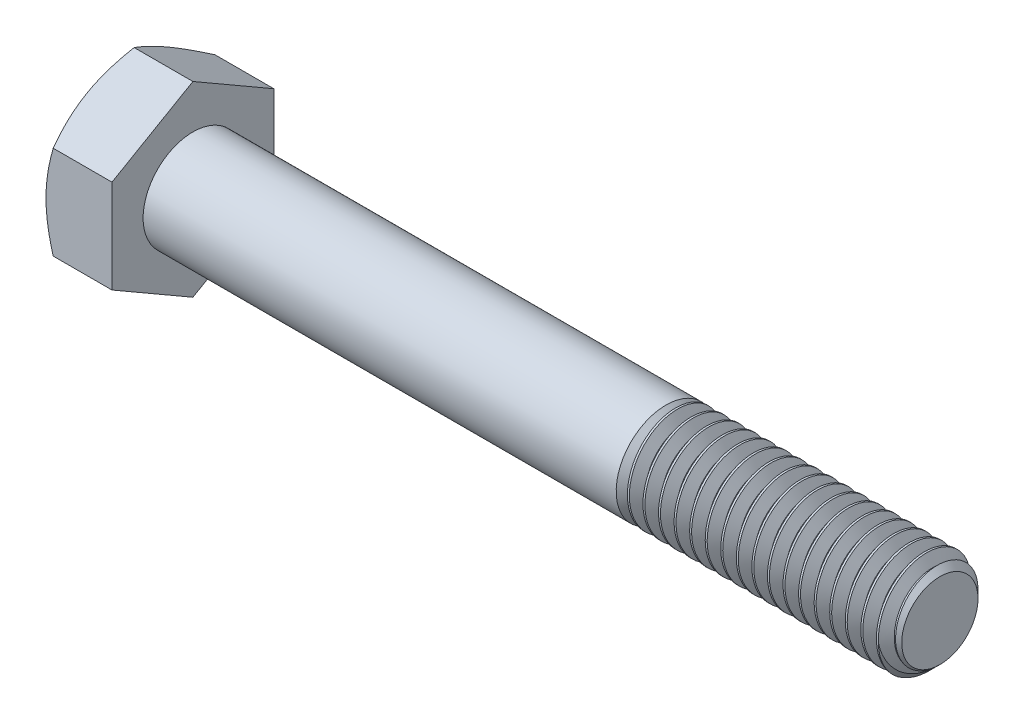
from build123d import *

# Parameters (mm, degrees)
SKETCH2_R           = 4
BOSS_EXTRUDE1_DEPTH = 60
CHAMFER1_SIZE       = 0.9375
CUT_SWEEP1_PITCH    = 1.25
BOSS_EXTRUDE2_DEPTH = 5.3
SKETCH6_OUTSIDE_W   = 260.92
SKETCH6_OUTSIDE_H   = 262.932
SKETCH6_OUTSIDE_R   = 6.5
CUT_EXTRUDE1_DEPTH  = 67.050536328
CUT_EXTRUDE1_DRAFT  = -60
SKETCH7_W           = 0.263417301
SKETCH7_H           = 0.263417301
CUT_EXTRUDE2_DEPTH  = 0.25


with BuildPart() as part:
    # Sketch2 → Boss-Extrude1 (new body)
    with BuildSketch(Plane(origin=(32.65, 0, 0), x_dir=(0, 0, -1), z_dir=(1, 0, 0))):
        Circle(SKETCH2_R)
    extrude(amount=-BOSS_EXTRUDE1_DEPTH)

    # Chamfer1
    chamfer1_edges = [part.edges().sort_by_distance(p)[0] for p in [
        (32.65, 0, 4),
    ]]
    chamfer(chamfer1_edges, length=CHAMFER1_SIZE)

    # Cut-Sweep1: arcs per turn and ends read off the stored shape
    # Cut-Sweep1: the profile of Sketch5 profile screwed along a right-hand helix through 49 turns, 8 arcs to a turn; built about Z, then put on its axis
    cut_sweep1_z = Axis((0, 0, 0), (0, 0, 1))
    cut_sweep1_corners = [(4.0003, 0, 0.000173205), (3.188101184, 0, -0.46875), (3.188101184, 0, -0.625), (4.0003, 0, -1.093923205)]
    with BuildLine(mode=Mode.PRIVATE) as cut_sweep1_profile:
        Line(cut_sweep1_corners[0], cut_sweep1_corners[1])
        Line(cut_sweep1_corners[1], cut_sweep1_corners[2])
        Line(cut_sweep1_corners[2], cut_sweep1_corners[3])
        Line(cut_sweep1_corners[3], cut_sweep1_corners[0])
    cut_sweep1_cap = Face(cut_sweep1_profile.wire())
    cut_sweep1_turn_angles = [0, 22.5, 45, 67.5, 90, 112.5, 135, 157.5, 180, 202.5, 225, 247.5, 270, 292.5, 315, 337.5, 360]
    cut_sweep1_turn_weights = [1, 0.9238795325112867, 1, 0.9238795325112867, 1, 0.9238795325112867, 1, 0.9238795325112867, 1, 0.9238795325112867, 1, 0.9238795325112867, 1, 0.9238795325112867, 1, 0.9238795325112867, 1]
    cut_sweep1_turn_rails = [Edge.make_bspline([Vector(p[0], p[1], 0).rotate(cut_sweep1_z, cut_sweep1_turn_angles[k]) / cut_sweep1_turn_weights[k] + Vector(0, 0, p[2] + CUT_SWEEP1_PITCH * cut_sweep1_turn_angles[k] / 360) for k in range(17)], [0, 0, 0, 1, 1, 2, 2, 3, 3, 4, 4, 5, 5, 6, 6, 7, 7, 8, 8, 8], 2, cut_sweep1_turn_weights) for p in cut_sweep1_corners]
    cut_sweep1_turn_sides = [Face.make_surface_from_curves(cut_sweep1_turn_rails[p[0]], cut_sweep1_turn_rails[p[1]]) for p in [(0, 1), (1, 2), (2, 3), (3, 0)]]
    cut_sweep1 = Plane(origin=(32.65, 0, 0), x_dir=(0, 1, 0), z_dir=(-1, 0, 0)) * Solid(Shell([*[p.moved(Location((0, 0, CUT_SWEEP1_PITCH * i))) for i in range(49) for p in cut_sweep1_turn_sides], cut_sweep1_cap, cut_sweep1_cap.rotate(cut_sweep1_z, 17640).moved(Location((0, 0, CUT_SWEEP1_PITCH * 17640 / 360)))]))
    add(cut_sweep1, mode=Mode.SUBTRACT)

    # Sketch3 → Boss-Extrude2 (add)
    with BuildSketch(Plane.ZY.offset(27.35)):
        Polygon((-6.5, -3.75277675), (0, -7.505553499), (6.5, -3.75277675), (6.5, 3.75277675), (0, 7.505553499), (-6.5, 3.75277675), align=None)
    extrude(amount=BOSS_EXTRUDE2_DEPTH)


with BuildPart() as cut_extrude1_tool:
    # Sketch6 outside → Cut-Extrude1 (with draft: the straight prism first)
    with BuildSketch(Plane.ZY.offset(32.65)):
        Rectangle(SKETCH6_OUTSIDE_W, SKETCH6_OUTSIDE_H)
        Circle(SKETCH6_OUTSIDE_R, mode=Mode.SUBTRACT)
    extrude(amount=-CUT_EXTRUDE1_DEPTH)
    # Cut-Extrude1: the draft: its side faces are tilted about the plane it starts from
    cut_extrude1_sides = [cut_extrude1_tool.faces().sort_by_distance(p)[0] for p in [
        (0.875268164, -131.466, 0),
        (0.875268164, 0, 130.46),
        (0.875268164, 131.466, 0),
        (0.875268164, 0, -130.46),
        (0.875268164, 0, -6.5),
    ]]
    draft(cut_extrude1_sides, Plane.ZY.offset(32.65), CUT_EXTRUDE1_DRAFT)


with BuildPart() as part_1:
    add(part.part)

    # Cut-Extrude1: cut by cut_extrude1_tool
    add(cut_extrude1_tool.part, mode=Mode.SUBTRACT)

    # Sketch7 → Cut-Extrude2 (cut)
    # profile 1 of 4: a face of its own
    with BuildSketch(Plane.ZY.offset(32.65)):
        with BuildLine():
            Line((-1.712212457, 3.25), (-1.975629758, 3.25))
            Line((-1.975629758, 3.25), (-1.975629758, 4.851083283))
            add(Edge.make_bspline(
                [(-1.975629758, 4.851083283), (-1.990797349, 4.836456007), (-2.022321526, 4.806054817), (-2.075609816, 4.763029542), (-2.135086359, 4.719421601), (-2.199978812, 4.677487692), (-2.266125691, 4.638011438), (-2.330048133, 4.602508617), (-2.390678926, 4.572464616), (-2.430616757, 4.556036438), (-2.449780899, 4.548153387)],
                knots=[0, 0, 0, 0, 0.893362401, 1.856755847, 2.901947673, 4.020460078, 5.132200827, 6.168787962, 7.121294059, 8, 8, 8, 8], degree=3))
            Line((-2.449780899, 4.548153387), (-2.449780899, 4.790991211))
            add(Edge.make_bspline(
                [(-2.449780899, 4.790991211), (-2.416864504, 4.807943221), (-2.351988236, 4.841354628), (-2.260332099, 4.899060722), (-2.174761236, 4.961616503), (-2.096692183, 5.029008122), (-2.026708251, 5.097894454), (-1.967731776, 5.167403469), (-1.918384014, 5.234987266), (-1.893625307, 5.28211947), (-1.881787344, 5.304654948)],
                knots=[0, 0, 0, 0, 1.141258006, 2.249351951, 3.335817539, 4.406819942, 5.426913362, 6.360259544, 7.215985427, 8, 8, 8, 8], degree=3))
            Line((-1.881787344, 5.304654948), (-1.712212457, 5.304654948))
            Line((-1.712212457, 5.304654948), (-1.712212457, 3.25))
        make_face()
    # profile 2 of 4: a face of its own
    with BuildSketch(Plane.ZY.offset(32.65)):
        with BuildLine():
            add(Edge.make_bspline(
                [(-1.053669204, 4.26333343), (-1.053403811, 4.292696335), (-1.052884018, 4.350205901), (-1.04965991, 4.434352728), (-1.044030879, 4.514263485), (-1.035628286, 4.589868774), (-1.025678041, 4.66133925), (-1.01274266, 4.728572918), (-0.998188475, 4.791720628), (-0.980726066, 4.850716558), (-0.961540595, 4.906067965), (-0.939774065, 4.957686055), (-0.915283767, 5.005516098), (-0.889273246, 5.05005412), (-0.860373255, 5.090607372), (-0.830328139, 5.128313943), (-0.796954399, 5.161790986), (-0.761639786, 5.191899869), (-0.723864284, 5.218469203), (-0.683827763, 5.241395334), (-0.641684272, 5.261637455), (-0.596630603, 5.276875718), (-0.549602061, 5.289298133), (-0.500236646, 5.298436212), (-0.448479956, 5.303823417), (-0.413111534, 5.30437464), (-0.395125952, 5.304654948)],
                knots=[0, 0, 0, 0, 1.514747001, 2.966751498, 4.343369068, 5.64627492, 6.890416844, 8.064737671, 9.177176366, 10.232018008, 11.237056675, 12.19799043, 13.119080079, 14.007588942, 14.855863561, 15.685992447, 16.491747269, 17.290132607, 18.077525251, 18.870243746, 19.668095604, 20.485086593, 21.319398728, 22.175900658, 23.072407314, 24, 24, 24, 24], degree=3))
            add(Edge.make_bspline(
                [(-0.395125952, 5.304654948), (-0.368738762, 5.303879183), (-0.316900071, 5.302355162), (-0.241215314, 5.289925525), (-0.169887308, 5.268662714), (-0.102962395, 5.239978266), (-0.041584646, 5.203543495), (0.01322827, 5.159251481), (0.060885109, 5.107567279), (0.100865769, 5.04787845), (0.135812857, 4.981831611), (0.166859083, 4.909130317), (0.194923969, 4.82985604), (0.214839423, 4.758894496), (0.2290451, 4.697637972), (0.23844813, 4.647115325), (0.246254529, 4.592601104), (0.252235287, 4.534227193), (0.257142357, 4.472059066), (0.260931862, 4.406058014), (0.262855424, 4.336059078), (0.263226498, 4.28802977), (0.263417301, 4.26333343)],
                knots=[0, 0, 0, 0, 1.134486744, 2.228744715, 3.287356444, 4.328707449, 5.352829806, 6.347195599, 7.349461267, 8.364207941, 9.428085653, 10.559314403, 11.761222316, 13.04268526, 13.726896727, 14.465273606, 15.252205015, 16.094778733, 16.988606776, 17.934225168, 18.937792761, 20, 20, 20, 20], degree=3))
            add(Edge.make_bspline(
                [(0.263417301, 4.26333343), (0.263146937, 4.234108446), (0.262618727, 4.177011689), (0.259481011, 4.093539578), (0.253512791, 4.014231709), (0.246168788, 3.93890641), (0.23505885, 3.867764764), (0.223087289, 3.80050451), (0.208281426, 3.737431068), (0.191006459, 3.678516795), (0.171550924, 3.623450173), (0.15021492, 3.57181504), (0.126583246, 3.523646677), (0.099952535, 3.479414897), (0.071541263, 3.438532594), (0.041141347, 3.400846412), (0.008108274, 3.366898762), (-0.027524579, 3.336880189), (-0.065034849, 3.309839686), (-0.105168706, 3.286687205), (-0.147750491, 3.267505776), (-0.192495698, 3.251106608), (-0.239858332, 3.239090259), (-0.289464895, 3.229891932), (-0.341498164, 3.224475291), (-0.377003388, 3.223934368), (-0.395125952, 3.22365827)],
                knots=[0, 0, 0, 0, 1.508974709, 2.94807912, 4.311757619, 5.615040294, 6.854280449, 8.028314546, 9.141715822, 10.197470207, 11.196696834, 12.155719058, 13.080757287, 13.963948316, 14.818758719, 15.649605906, 16.461113142, 17.260189315, 18.052359509, 18.845763934, 19.647754795, 20.461145776, 21.303032214, 22.167241874, 23.064524267, 24, 24, 24, 24], degree=3))
            add(Edge.make_bspline(
                [(-0.395125952, 3.22365827), (-0.418886733, 3.224336047), (-0.465213718, 3.225657527), (-0.532870864, 3.234636168), (-0.596370704, 3.250438997), (-0.656248823, 3.271632819), (-0.711832175, 3.299980776), (-0.763386148, 3.334471601), (-0.811946681, 3.37430283), (-0.839901077, 3.405728755), (-0.854048281, 3.421632835)],
                knots=[0, 0, 0, 0, 1.10322584, 2.150986741, 3.161425019, 4.136713905, 5.093944212, 6.049774532, 7.013026876, 8, 8, 8, 8], degree=3))
            add(Edge.make_bspline(
                [(-0.854048281, 3.421632835), (-0.870332038, 3.445122393), (-0.903909841, 3.493558868), (-0.943209749, 3.57614755), (-0.978265963, 3.667066094), (-1.005778664, 3.76809831), (-1.027327966, 3.878440095), (-1.042891943, 3.998307965), (-1.051699622, 4.127650132), (-1.052997856, 4.217084674), (-1.053669204, 4.26333343)],
                knots=[0, 0, 0, 0, 0.779365345, 1.607084704, 2.489375761, 3.438383567, 4.461919411, 5.557722155, 6.737039282, 8, 8, 8, 8], degree=3))
        make_face()
        with BuildLine():
            add(Edge.make_bspline(
                [(-0.790251903, 4.264156609), (-0.789990351, 4.224638121), (-0.789489681, 4.148990994), (-0.784258903, 4.040916022), (-0.775254335, 3.943417645), (-0.763349706, 3.856630855), (-0.747630777, 3.780438257), (-0.727893802, 3.715034013), (-0.705645537, 3.659633124), (-0.678113731, 3.61492224), (-0.647969444, 3.578476348), (-0.616847528, 3.547131701), (-0.584015791, 3.52048947), (-0.549688457, 3.498275282), (-0.513332913, 3.481456158), (-0.4753467, 3.46926562), (-0.435721553, 3.462250153), (-0.408735027, 3.461242162), (-0.395125952, 3.460733841)],
                knots=[0, 0, 0, 0, 1.89448813, 3.626469325, 5.185477471, 6.587276848, 7.82441448, 8.910550357, 9.859733512, 10.6775885, 11.416198291, 12.123144072, 12.791880183, 13.439617036, 14.078171869, 14.70637855, 15.347637704, 16, 16, 16, 16], degree=3))
            add(Edge.make_bspline(
                [(-0.395125952, 3.460733841), (-0.381520284, 3.461253269), (-0.354540516, 3.462283284), (-0.314823811, 3.469144054), (-0.276985394, 3.481962153), (-0.240684056, 3.498721871), (-0.206107221, 3.520429731), (-0.17343673, 3.547172596), (-0.14215087, 3.578498631), (-0.11214199, 3.615368141), (-0.084819938, 3.660285738), (-0.062154323, 3.715641498), (-0.042724938, 3.781160284), (-0.026919756, 3.857314062), (-0.014966019, 3.943963635), (-0.006015893, 4.041191596), (-0.000750109, 4.149127511), (-0.000257703, 4.224637943), (0, 4.264156609)],
                knots=[0, 0, 0, 0, 0.652509534, 1.29391342, 1.924290653, 2.562989607, 3.207355802, 3.876242846, 4.583348185, 5.32723334, 6.150888545, 7.094226006, 8.186903555, 9.424320409, 10.81992305, 12.379283064, 14.105084285, 16, 16, 16, 16], degree=3))
            add(Edge.make_bspline(
                [(0, 4.264156609), (-0.000249452, 4.30285302), (-0.000727391, 4.376993878), (-0.006128987, 4.482986783), (-0.014593772, 4.57884869), (-0.026172254, 4.664667974), (-0.041560054, 4.740351467), (-0.060223356, 4.806060288), (-0.082463471, 4.861654304), (-0.108906889, 4.907691956), (-0.138343703, 4.94545532), (-0.169093247, 4.978142798), (-0.201924261, 5.005942433), (-0.237418413, 5.02824371), (-0.274431658, 5.046235551), (-0.313814468, 5.058617994), (-0.35517974, 5.06622538), (-0.38356819, 5.067122888), (-0.398007078, 5.067579377)],
                knots=[0, 0, 0, 0, 1.850066095, 3.544656626, 5.0727657, 6.45041401, 7.682899467, 8.762389858, 9.712573485, 10.538438529, 11.291566246, 11.996865408, 12.681389046, 13.341983376, 13.996294293, 14.643563182, 15.31009126, 16, 16, 16, 16], degree=3))
            add(Edge.make_bspline(
                [(-0.398007078, 5.067579377), (-0.411615299, 5.067222215), (-0.438448966, 5.066517937), (-0.47773697, 5.059795612), (-0.514969749, 5.048554386), (-0.550573872, 5.033327055), (-0.583660499, 5.012834074), (-0.615541766, 4.98890706), (-0.644724475, 4.959754665), (-0.66230972, 4.93796079), (-0.671302528, 4.926815757)],
                knots=[0, 0, 0, 0, 1.021318143, 2.013908504, 2.982026795, 3.937174072, 4.91255697, 5.897578595, 6.924855925, 8, 8, 8, 8], degree=3))
            add(Edge.make_bspline(
                [(-0.671302528, 4.926815757), (-0.681092952, 4.910447155), (-0.701768267, 4.875880115), (-0.724902742, 4.815801176), (-0.745338823, 4.747142384), (-0.762164493, 4.668847374), (-0.774336685, 4.581050453), (-0.78394616, 4.483853581), (-0.788937924, 4.37712106), (-0.789801826, 4.302850334), (-0.790251903, 4.264156609)],
                knots=[0, 0, 0, 0, 0.671104906, 1.417232262, 2.260109084, 3.195198885, 4.23592645, 5.382417421, 6.636286093, 8, 8, 8, 8], degree=3))
        make_face(mode=Mode.SUBTRACT)
    # profile 3 of 4: a face of its own
    with BuildSketch(Plane.ZY.offset(32.65)):
        with Locations((0.790251904, 3.381708651)):
            Rectangle(SKETCH7_W, SKETCH7_H)
    # profile 4 of 4: a face of its own
    with BuildSketch(Plane.ZY.offset(32.65)):
        with BuildLine():
            Line((1.343428235, 3.750492872), (1.606845536, 3.776834602))
            add(Edge.make_bspline(
                [(1.606845536, 3.776834602), (1.609226986, 3.763338136), (1.61383053, 3.737248323), (1.624219278, 3.700065869), (1.634756016, 3.665396831), (1.648357527, 3.634013553), (1.662522508, 3.605063578), (1.678563961, 3.578837007), (1.69676769, 3.555860592), (1.722473745, 3.52893633), (1.758946895, 3.500840405), (1.809503625, 3.478081611), (1.865120776, 3.462779267), (1.904315553, 3.461431235), (1.924592656, 3.460733841)],
                knots=[0, 0, 0, 0, 0.994516507, 1.922484754, 2.80151264, 3.623050913, 4.402748861, 5.140924173, 5.850441436, 6.526872911, 7.841975818, 9.161260782, 10.53140107, 12, 12, 12, 12], degree=3))
            add(Edge.make_bspline(
                [(1.924592656, 3.460733841), (1.942335318, 3.46137277), (1.977255627, 3.462630282), (2.028170595, 3.472378616), (2.076589938, 3.487995243), (2.121670811, 3.510401832), (2.163249141, 3.537670026), (2.199566411, 3.570070133), (2.231107568, 3.606206721), (2.257012656, 3.647843004), (2.279123348, 3.695398627), (2.300015011, 3.7494784), (2.319778178, 3.811014023), (2.337342519, 3.879220631), (2.353070526, 3.951608123), (2.36410829, 4.026536277), (2.370899396, 4.102548373), (2.37162589, 4.153699284), (2.371990478, 4.179369165)],
                knots=[0, 0, 0, 0, 0.897794352, 1.766998465, 2.614902619, 3.466100941, 4.308008728, 5.124841802, 5.922729683, 6.728261092, 7.598214292, 8.574707161, 9.662086263, 10.868425066, 12.139522319, 13.41071447, 14.70057738, 16, 16, 16, 16], degree=3))
            add(Edge.make_bspline(
                [(2.371990478, 4.179369165), (2.371865792, 4.186366486), (2.371567489, 4.203107167), (2.371054359, 4.219842715), (2.370755709, 4.229583088)],
                knots=[0, 0, 0, 0, 0.835966126, 2, 2, 2, 2], degree=3))
            add(Edge.make_bspline(
                [(2.370755709, 4.229583088), (2.358056779, 4.21029884), (2.332679381, 4.171761418), (2.285927945, 4.120039532), (2.232443482, 4.074161517), (2.173037847, 4.03448362), (2.109177907, 4.001920759), (2.041974623, 3.978259264), (1.972007314, 3.963648603), (1.924388684, 3.962040101), (1.900308873, 3.961226713)],
                knots=[0, 0, 0, 0, 0.978840568, 1.956103883, 2.947027447, 3.962820877, 4.980997961, 5.980964245, 6.979013046, 8, 8, 8, 8], degree=3))
            add(Edge.make_bspline(
                [(1.900308873, 3.961226713), (1.880242283, 3.961746616), (1.840740816, 3.962770056), (1.782878116, 3.971866063), (1.72722554, 3.985506849), (1.674310458, 4.00615966), (1.623309587, 4.031701873), (1.574758435, 4.063052981), (1.528582191, 4.100170311), (1.485377524, 4.142591689), (1.445949465, 4.189875867), (1.411178467, 4.240870912), (1.382304678, 4.295826174), (1.358280685, 4.35405573), (1.339743646, 4.416122198), (1.32686283, 4.48188015), (1.318199864, 4.551078568), (1.317462547, 4.598477128), (1.317086505, 4.622651092)],
                knots=[0, 0, 0, 0, 0.975490236, 1.920271282, 2.842894855, 3.757591483, 4.67685385, 5.613562631, 6.563069669, 7.554119451, 8.55387214, 9.553424333, 10.550567425, 11.568071726, 12.613215376, 13.695622473, 14.824733476, 16, 16, 16, 16], degree=3))
            add(Edge.make_bspline(
                [(1.317086505, 4.622651092), (1.317649718, 4.647643937), (1.318751461, 4.696534277), (1.327073801, 4.768018026), (1.340842359, 4.835739983), (1.360921901, 4.899570884), (1.385753581, 4.95992086), (1.417065367, 5.016354799), (1.453651568, 5.069114111), (1.495730787, 5.117690149), (1.541975466, 5.161276301), (1.591073928, 5.200177701), (1.643665963, 5.232154466), (1.698743165, 5.25881511), (1.756722343, 5.279418859), (1.817504403, 5.294311039), (1.88125754, 5.303049305), (1.924702865, 5.304113318), (1.94681849, 5.304654948)],
                knots=[0, 0, 0, 0, 1.151671969, 2.252870106, 3.311924673, 4.331900944, 5.332425074, 6.314476151, 7.300265758, 8.286521684, 9.270545387, 10.225535917, 11.167946231, 12.101233205, 13.04124339, 13.998220545, 14.981004193, 16, 16, 16, 16], degree=3))
            add(Edge.make_bspline(
                [(1.94681849, 5.304654948), (1.962880806, 5.304330093), (1.99480732, 5.30368439), (2.0423206, 5.298754658), (2.088708773, 5.289868011), (2.134274283, 5.278650564), (2.178248567, 5.263079902), (2.221479299, 5.245074026), (2.263445052, 5.223051477), (2.304390355, 5.198009079), (2.344058042, 5.170387031), (2.3805546, 5.138652287), (2.415338776, 5.104974281), (2.447702759, 5.068296042), (2.476622878, 5.028051504), (2.504062511, 4.985663509), (2.52869893, 4.940207137), (2.551165634, 4.891620825), (2.571161871, 4.838904439), (2.587843743, 4.780893002), (2.602143829, 4.717385587), (2.614050061, 4.648298015), (2.622878726, 4.573679539), (2.629376108, 4.493641057), (2.633629665, 4.408121689), (2.633988336, 4.349223752), (2.63417301, 4.318898017)],
                knots=[0, 0, 0, 0, 0.850689348, 1.69088598, 2.526071361, 3.350886897, 4.173587108, 4.994166539, 5.82944675, 6.680632524, 7.535501428, 8.385942454, 9.238956306, 10.098905971, 10.972410977, 11.861345628, 12.77184846, 13.708225841, 14.694799433, 15.754852217, 16.902446579, 18.141290626, 19.466225842, 20.880733292, 22.39393263, 24, 24, 24, 24], degree=3))
            add(Edge.make_bspline(
                [(2.63417301, 4.318898017), (2.6339871, 4.287200532), (2.633624768, 4.225423409), (2.629337817, 4.135244488), (2.622843702, 4.049998487), (2.614008798, 3.969629425), (2.602019565, 3.894259963), (2.587769409, 3.823903275), (2.570963778, 3.758429473), (2.551214715, 3.697832808), (2.528763845, 3.641416901), (2.504164324, 3.588487072), (2.476614223, 3.539121596), (2.446423095, 3.493225799), (2.413978613, 3.450719463), (2.37877421, 3.411716455), (2.340798452, 3.376334676), (2.300535409, 3.344175938), (2.258045506, 3.315836014), (2.213907178, 3.290829556), (2.167622297, 3.27034489), (2.119666686, 3.253540006), (2.070125559, 3.239664847), (2.018595398, 3.23031574), (1.965314272, 3.225020725), (1.929268891, 3.224116369), (1.911010201, 3.22365827)],
                knots=[0, 0, 0, 0, 1.538356107, 2.998194159, 4.380716326, 5.687456969, 6.921258146, 8.08355215, 9.170518603, 10.200253214, 11.174652363, 12.115998813, 13.031191965, 13.915860606, 14.780247615, 15.624154577, 16.462764255, 17.29681422, 18.1223677, 18.939254916, 19.756006416, 20.575278551, 21.404021733, 22.250368457, 23.113728878, 24, 24, 24, 24], degree=3))
            add(Edge.make_bspline(
                [(1.911010201, 3.22365827), (1.891643664, 3.223993119), (1.853752955, 3.224648253), (1.798436419, 3.231537028), (1.745740074, 3.242010212), (1.695817287, 3.257471112), (1.648294181, 3.276503064), (1.603981885, 3.300824816), (1.562092911, 3.328884843), (1.523144042, 3.361248996), (1.487591314, 3.397798428), (1.45542289, 3.437632363), (1.42722066, 3.481266718), (1.403132215, 3.528444239), (1.381795442, 3.57876802), (1.365253639, 3.632912869), (1.351815016, 3.690379413), (1.346268973, 3.730131475), (1.343428235, 3.750492872)],
                knots=[0, 0, 0, 0, 1.08199657, 2.11693069, 3.111083497, 4.081436044, 5.034173265, 5.967546613, 6.901297947, 7.84883568, 8.792454994, 9.747011506, 10.706361727, 11.690764787, 12.70483191, 13.757514363, 14.851376857, 16, 16, 16, 16], degree=3))
        make_face()
        with BuildLine():
            add(Edge.make_bspline(
                [(2.370755709, 4.628413345), (2.370459446, 4.644889997), (2.369882788, 4.676960744), (2.364830564, 4.723751563), (2.356701567, 4.767814617), (2.345291922, 4.809403273), (2.329797284, 4.848076676), (2.311847803, 4.884737747), (2.289897393, 4.918370349), (2.26513021, 4.949427371), (2.237848658, 4.97720716), (2.208139299, 5.001428652), (2.176559161, 5.022191962), (2.142350633, 5.038517507), (2.106638259, 5.051969698), (2.068564179, 5.060761527), (2.028652287, 5.066920378), (2.00117341, 5.06735675), (1.987154265, 5.067579377)],
                knots=[0, 0, 0, 0, 1.20361398, 2.342757417, 3.433960756, 4.474970456, 5.487648377, 6.473933575, 7.452701285, 8.415527761, 9.372491588, 10.291530068, 11.211879743, 12.12647906, 13.055739058, 13.994253148, 14.97671008, 16, 16, 16, 16], degree=3))
            add(Edge.make_bspline(
                [(1.987154265, 5.067579377), (1.972734284, 5.067142412), (1.944326885, 5.066281591), (1.902690191, 5.060737863), (1.863202918, 5.050123331), (1.82559848, 5.036043394), (1.789459226, 5.018626761), (1.756098961, 4.995805648), (1.724120441, 4.969943671), (1.694806273, 4.939940334), (1.668028748, 4.907044916), (1.644434797, 4.871566178), (1.624565701, 4.833486737), (1.608682838, 4.792965357), (1.595702867, 4.750355226), (1.58678655, 4.705275342), (1.581300213, 4.657773697), (1.580773232, 4.625273277), (1.580503806, 4.608657048)],
                knots=[0, 0, 0, 0, 1.007165334, 1.984118292, 2.925321257, 3.856078893, 4.785899085, 5.718627206, 6.671847665, 7.654235469, 8.641842333, 9.630378272, 10.624608936, 11.635186472, 12.665777387, 13.731187195, 14.840042241, 16, 16, 16, 16], degree=3))
            add(Edge.make_bspline(
                [(1.580503806, 4.608657048), (1.580752641, 4.593818186), (1.58124051, 4.564724947), (1.587050486, 4.522266014), (1.594800132, 4.481742842), (1.607154533, 4.443569068), (1.622037996, 4.407190484), (1.641381922, 4.373442578), (1.66316134, 4.341316222), (1.688680145, 4.311887654), (1.716891239, 4.285190782), (1.74770348, 4.261921586), (1.780727677, 4.242002749), (1.81627064, 4.225970909), (1.854119219, 4.213624034), (1.894188934, 4.204534243), (1.936653958, 4.199120139), (1.965735789, 4.198578529), (1.980568832, 4.198302284)],
                knots=[0, 0, 0, 0, 1.102204012, 2.160993585, 3.181057555, 4.164839289, 5.138418409, 6.097303793, 7.050641095, 8.019669129, 8.986440483, 9.932879371, 10.884360123, 11.847412593, 12.824617322, 13.839006415, 14.897795988, 16, 16, 16, 16], degree=3))
            add(Edge.make_bspline(
                [(1.980568832, 4.198302284), (1.994442526, 4.198581229), (2.021749061, 4.199130255), (2.061750264, 4.204567439), (2.099758927, 4.213674087), (2.135945704, 4.226054959), (2.170251941, 4.242081256), (2.202446951, 4.262158383), (2.233153085, 4.285161675), (2.261470231, 4.312039898), (2.287351065, 4.341799347), (2.309733175, 4.37473402), (2.328846295, 4.410245813), (2.343890266, 4.448755659), (2.355939774, 4.489789433), (2.364423428, 4.533606928), (2.369979224, 4.580114604), (2.370492966, 4.612070273), (2.370755709, 4.628413345)],
                knots=[0, 0, 0, 0, 1.017004716, 2.00169281, 2.953445817, 3.879374072, 4.80207141, 5.723561102, 6.657273834, 7.611045633, 8.581233951, 9.544037932, 10.525327521, 11.53237926, 12.57032081, 13.657564536, 14.802009319, 16, 16, 16, 16], degree=3))
        make_face(mode=Mode.SUBTRACT)
    extrude(amount=-CUT_EXTRUDE2_DEPTH, mode=Mode.SUBTRACT)

    # Sketch9 → Revolve1 (revolve)
    with BuildSketch(Plane.XY, mode=Mode.PRIVATE) as revolve1_sk:
        Polygon((-27.35, 4), (-27.35, 0), (14.65, 0), (10.65, 4), align=None)
    revolve(revolve1_sk.sketch.rotate(Axis((-27.35, 0, 0), (1, 0, 0)), 270), axis=Axis((-27.35, 0, 0), (1, 0, 0)))


solid = part_1.part
